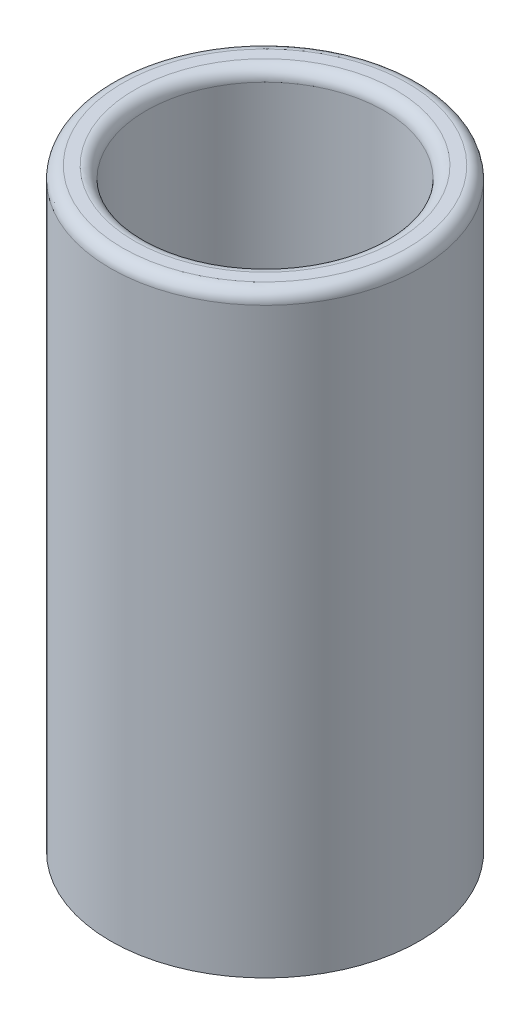
from build123d import *

# Parameters (mm, degrees)
SKETCH1_R               = 6.5
BOSS_EXTRUDE1_DEPTH     = 25
SKETCH2_W               = 5
SKETCH2_H               = 3
CUT_EXTRUDE1_DEPTH      = 7
CUT_EXTRUDE3_DEPTH      = 27.636441204
CUT_EXTRUDE3_DEPTH_BACK = 18
SKETCH4_R               = 5
FILLET6_R               = 0.5
FILLET7_R               = 0.5


with BuildPart() as part:
    # Sketch1 → Boss-Extrude1 (new body)
    with BuildSketch(Plane(origin=(0, 0, 0), x_dir=(1, 0, 0), z_dir=(0, 1, 0))):
        Circle(SKETCH1_R)
    extrude(amount=BOSS_EXTRUDE1_DEPTH)

    # Sketch2 → Cut-Extrude1 (cut)
    with BuildSketch(Plane.XZ):
        Rectangle(SKETCH2_W, SKETCH2_H)
    extrude(amount=-CUT_EXTRUDE1_DEPTH, mode=Mode.SUBTRACT)

    # Sketch4 → Cut-Extrude3 (cut, two sides: drawn at the far end of the back side and taken through both)
    with BuildSketch(Plane(origin=(0, 25, 0), x_dir=(1, 0, 0), z_dir=(0, 1, 0)).offset(-CUT_EXTRUDE3_DEPTH_BACK)):
        Circle(SKETCH4_R)
    extrude(amount=CUT_EXTRUDE3_DEPTH + CUT_EXTRUDE3_DEPTH_BACK, mode=Mode.SUBTRACT)

    # Fillet6
    fillet6_edges = [part.edges().sort_by_distance(p)[0] for p in [
        (-5, 25, 0),
    ]]
    fillet(fillet6_edges, radius=FILLET6_R)

    # Fillet7
    fillet7_edges = [part.edges().sort_by_distance(p)[0] for p in [
        (-6.5, 25, 0),
    ]]
    fillet(fillet7_edges, radius=FILLET7_R)


solid = part.part
